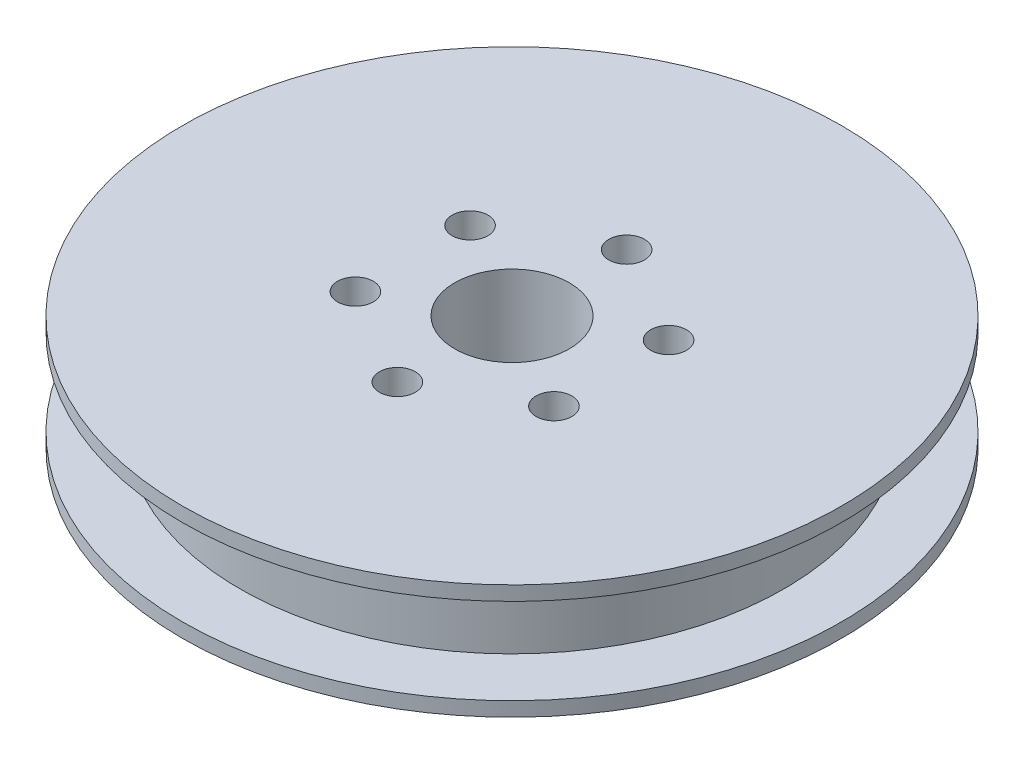
from build123d import *

# Parameters (mm, degrees)
SKETCH2_R           = 60.325
SKETCH2_R_2         = 3.96875
SKETCH2_R_3         = 12.7
BOSS_EXTRUDE1_DEPTH = 19.05
SKETCH3_R           = 73.025
SKETCH3_R_2         = 3.96875
SKETCH3_R_3         = 12.7
BOSS_EXTRUDE2_DEPTH = 3.175
BOSS_EXTRUDE3_START = 3.175
SKETCH4_R           = 73.025
SKETCH4_R_2         = 12.7
SKETCH4_R_3         = 3.96875
BOSS_EXTRUDE3_DEPTH = 3.175


with BuildPart() as part:
    # Sketch2 → Boss-Extrude1 (new body)
    with BuildSketch(Plane(origin=(0, 0, 0), x_dir=(1, 0, 0), z_dir=(0, 1, 0))):
        Circle(SKETCH2_R)
        with Locations((21.997045256, 12.7)):
            Circle(SKETCH2_R_2, mode=Mode.SUBTRACT)
        with Locations((0, 25.4)):
            Circle(SKETCH2_R_2, mode=Mode.SUBTRACT)
        with Locations((-21.997045256, 12.7)):
            Circle(SKETCH2_R_2, mode=Mode.SUBTRACT)
        with Locations((-21.997045256, -12.7)):
            Circle(SKETCH2_R_2, mode=Mode.SUBTRACT)
        with Locations((0, -25.4)):
            Circle(SKETCH2_R_2, mode=Mode.SUBTRACT)
        with Locations((21.997045256, -12.7)):
            Circle(SKETCH2_R_2, mode=Mode.SUBTRACT)
        Circle(SKETCH2_R_3, mode=Mode.SUBTRACT)
    extrude(amount=BOSS_EXTRUDE1_DEPTH)

    # Sketch3 → Boss-Extrude2 (add)
    with BuildSketch(Plane(origin=(0, 19.05, 0), x_dir=(1, 0, 0), z_dir=(0, 1, 0))):
        Circle(SKETCH3_R)
        with Locations((0, 25.4)):
            Circle(SKETCH3_R_2, mode=Mode.SUBTRACT)
        with Locations((21.997045256, 12.7)):
            Circle(SKETCH3_R_2, mode=Mode.SUBTRACT)
        with Locations((21.997045256, -12.7)):
            Circle(SKETCH3_R_2, mode=Mode.SUBTRACT)
        with Locations((0, -25.4)):
            Circle(SKETCH3_R_2, mode=Mode.SUBTRACT)
        with Locations((-21.997045256, -12.7)):
            Circle(SKETCH3_R_2, mode=Mode.SUBTRACT)
        Circle(SKETCH3_R_3, mode=Mode.SUBTRACT)
        with Locations((-21.997045256, 12.7)):
            Circle(SKETCH3_R_2, mode=Mode.SUBTRACT)
    extrude(amount=BOSS_EXTRUDE2_DEPTH)

    # Sketch4 → Boss-Extrude3 (add)
    with BuildSketch(Plane.XZ.offset(BOSS_EXTRUDE3_START)):
        Circle(SKETCH4_R)
        Circle(SKETCH4_R_2, mode=Mode.SUBTRACT)
        with Locations((-21.997045256, -12.7)):
            Circle(SKETCH4_R_3, mode=Mode.SUBTRACT)
        with Locations((0, -25.4)):
            Circle(SKETCH4_R_3, mode=Mode.SUBTRACT)
        with Locations((21.997045256, -12.7)):
            Circle(SKETCH4_R_3, mode=Mode.SUBTRACT)
        with Locations((21.997045256, 12.7)):
            Circle(SKETCH4_R_3, mode=Mode.SUBTRACT)
        with Locations((0, 25.4)):
            Circle(SKETCH4_R_3, mode=Mode.SUBTRACT)
        with Locations((-21.997045256, 12.7)):
            Circle(SKETCH4_R_3, mode=Mode.SUBTRACT)
    extrude(amount=-BOSS_EXTRUDE3_DEPTH)


solid = part.part
